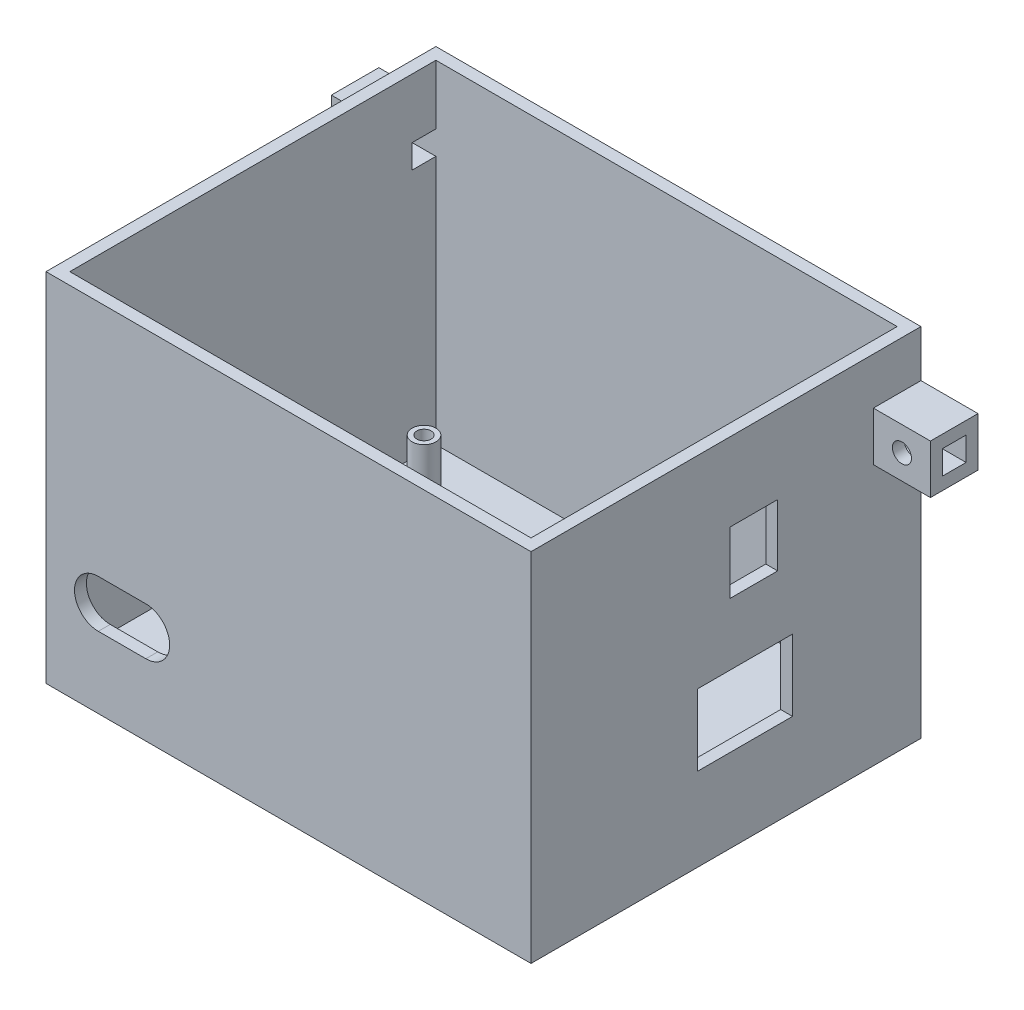
from build123d import *

# Parameters (mm, degrees)
SKETCH1_W               = 102
SKETCH1_H               = 82
BOSS_EXTRUDE1_DEPTH     = 5
SKETCH2_W               = 102
SKETCH2_H               = 82
SKETCH2_W_2             = 97
SKETCH2_H_2             = 77
BOSS_EXTRUDE2_DEPTH     = 70
CUT_EXTRUDE1_DEPTH      = 3
SKETCH5_W               = 12
SKETCH5_H               = 10.304098564
SKETCH5_R               = 2
BOSS_EXTRUDE4_DEPTH     = 10
SKETCH9_W               = 20
SKETCH9_H               = 15
SKETCH9_W_2             = 10
SKETCH9_H_2             = 13
CUT_EXTRUDE7_DEPTH      = 10
SKETCH10_R              = 2.5
BOSS_EXTRUDE5_DEPTH     = 10
SKETCH11_R              = 1.5
CUT_EXTRUDE8_DEPTH      = 10
CUT_EXTRUDE9_DEPTH      = 143.485086939
CUT_EXTRUDE9_DEPTH_BACK = 143.485086939
SKETCH12_W              = 5
SKETCH12_H              = 5


with BuildPart() as part:
    # Sketch1 → Boss-Extrude1 (new body)
    with BuildSketch(Plane(origin=(0, 0, 0), x_dir=(1, 0, 0), z_dir=(0, 1, 0))):
        Rectangle(SKETCH1_W, SKETCH1_H)
    extrude(amount=BOSS_EXTRUDE1_DEPTH)

    # Sketch2 → Boss-Extrude2 (add)
    with BuildSketch(Plane(origin=(0, 5, 0), x_dir=(1, 0, 0), z_dir=(0, 1, 0))):
        Rectangle(SKETCH2_W, SKETCH2_H)
        Rectangle(SKETCH2_W_2, SKETCH2_H_2, mode=Mode.SUBTRACT)
    extrude(amount=BOSS_EXTRUDE2_DEPTH)

    # Sketch4 → Cut-Extrude1 (cut)
    with BuildSketch(Plane.XY.offset(41)):
        with BuildLine():
            Line((-40, 25), (-30, 25))
            ThreePointArc((-30, 25), (-25, 20), (-30, 15))
            Line((-30, 15), (-40, 15))
            ThreePointArc((-40, 15), (-45, 20), (-40, 25))
        make_face()
    extrude(amount=-CUT_EXTRUDE1_DEPTH, mode=Mode.SUBTRACT)

    # Sketch5 → Boss-Extrude4 (add)
    # profile 1 of 2: a face of its own
    with BuildSketch(Plane(origin=(0, 0, -41), x_dir=(-1, 0, 0), z_dir=(0, 0, -1))):
        with Locations((57, 60)):
            Rectangle(SKETCH5_W, SKETCH5_H)
        with Locations((57, 60)):
            Circle(SKETCH5_R, mode=Mode.SUBTRACT)
    # profile 2 of 2: a face of its own
    with BuildSketch(Plane(origin=(0, 0, -41), x_dir=(-1, 0, 0), z_dir=(0, 0, -1))):
        with Locations((-57, 60)):
            Rectangle(SKETCH5_W, SKETCH5_H)
        with Locations((-57, 60)):
            Circle(SKETCH5_R, mode=Mode.SUBTRACT)
    extrude(amount=-BOSS_EXTRUDE4_DEPTH)

    # Sketch9 → Cut-Extrude7 (cut)
    with BuildSketch(Plane(origin=(51, 0, 0), x_dir=(0, 0, -1), z_dir=(1, 0, 0))):
        with Locations((4, 25)):
            Rectangle(SKETCH9_W, SKETCH9_H)
        with Locations((5.875245753, 52.06044871)):
            Rectangle(SKETCH9_W_2, SKETCH9_H_2)
    extrude(amount=-CUT_EXTRUDE7_DEPTH, mode=Mode.SUBTRACT)

    # Sketch10 → Boss-Extrude5 (add)
    with BuildSketch(Plane(origin=(0, 5, 0), x_dir=(1, 0, 0), z_dir=(0, 1, 0))):
        with Locations((16.5, -20)):
            Circle(SKETCH10_R)
        with Locations((-41.5, -20)):
            Circle(SKETCH10_R)
        with Locations((16.5, 29)):
            Circle(SKETCH10_R)
        with Locations((-41.5, 29)):
            Circle(SKETCH10_R)
    extrude(amount=BOSS_EXTRUDE5_DEPTH)

    # Sketch11 → Cut-Extrude8 (cut)
    with BuildSketch(Plane(origin=(0, 5, 0), x_dir=(1, 0, 0), z_dir=(0, 1, 0))):
        with Locations((-41.5, 29)):
            Circle(SKETCH11_R)
        with Locations((16.5, 29)):
            Circle(SKETCH11_R)
        with Locations((-41.5, -20)):
            Circle(SKETCH11_R)
        with Locations((16.5, -20)):
            Circle(SKETCH11_R)
    extrude(amount=CUT_EXTRUDE8_DEPTH, mode=Mode.SUBTRACT)

    # Sketch12 → Cut-Extrude9 (cut, two sides: drawn at the far end of the back side and taken through both)
    with BuildSketch(Plane(origin=(51, 0, 0), x_dir=(0, 0, -1), z_dir=(1, 0, 0)).offset(-CUT_EXTRUDE9_DEPTH_BACK)):
        with Locations((36, 60)):
            Rectangle(SKETCH12_W, SKETCH12_H)
    extrude(amount=CUT_EXTRUDE9_DEPTH + CUT_EXTRUDE9_DEPTH_BACK, mode=Mode.SUBTRACT)


solid = part.part
